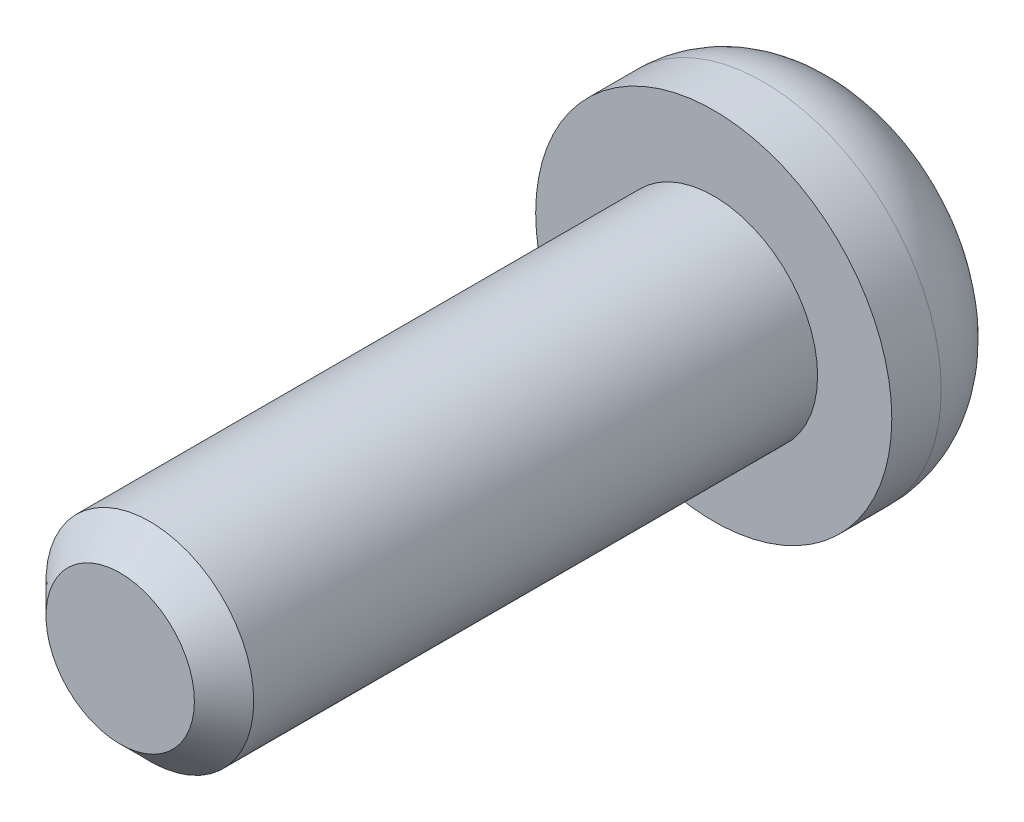
from build123d import *

# Parameters (mm, degrees)
SKICA1_R                 = 1.8
P_IDAT_VYSUNUT_M1_DEPTH  = 1.4
ODEBRAT_VYSUNUT_M1_DEPTH = 0.8
SKICA4_R                 = 1.05
P_IDAT_VYSUNUT_M2_DEPTH  = 6
ZKOSEN_1_SIZE            = 0.3
ZAOBLIT1_R               = 0.9


with BuildPart() as part:
    # Skica1 → Přidat vysunutím1 (new body)
    with BuildSketch(Plane.XY):
        Circle(SKICA1_R)
    extrude(amount=P_IDAT_VYSUNUT_M1_DEPTH)

    # Skica2 → Odebrat vysunutím1 (cut)
    with BuildSketch(Plane(origin=(0, 0, 0), x_dir=(-1, 0, 0), z_dir=(0, 0, -1))):
        Polygon((-0.443511417, 0.411741974), (-1.244198575, 0.411741974), (-1.244198575, -0.411741974), (-0.443511417, -0.411741974), (-0.443511417, -1.388921302), (0, -1.388921302), (0.443511417, -1.388921302), (0.443511417, -0.411741974), (1.244198575, -0.411741974), (1.244198575, 0.411741974), (0.443511417, 0.411741974), (0.443511417, 1.388921302), (0, 1.388921302), (-0.443511417, 1.388921302), align=None)
    extrude(amount=-ODEBRAT_VYSUNUT_M1_DEPTH, mode=Mode.SUBTRACT)

    # Skica4 → Přidat vysunutím2 (add)
    with BuildSketch(Plane.XY.offset(1.4)):
        Circle(SKICA4_R)
    extrude(amount=P_IDAT_VYSUNUT_M2_DEPTH)

    # Zkosení1
    zkosen_1_edges = [part.edges().sort_by_distance(p)[0] for p in [
        (-1.05, 0, 7.4),
    ]]
    chamfer(zkosen_1_edges, length=ZKOSEN_1_SIZE)

    # Zaoblit1
    # the kernel refuses this fillet: 0.9 mm, written as the material it takes off along each edge
    with BuildSketch(Plane(origin=(0, 0, 0), x_dir=(1, 0, 0), z_dir=(0, -1, 0))) as zaoblit1_piece_1:
        with BuildLine():
            CenterArc((1.8 - ZAOBLIT1_R, ZAOBLIT1_R), ZAOBLIT1_R, 270, 90)
            Line((1.8 - ZAOBLIT1_R, 0), (1.8, 0))
            Line((1.8, 0), (1.8, ZAOBLIT1_R))
        make_face()
    revolve(axis=Axis((0, 0, 0), (0, 0, 1)), mode=Mode.SUBTRACT)


solid = part.part
